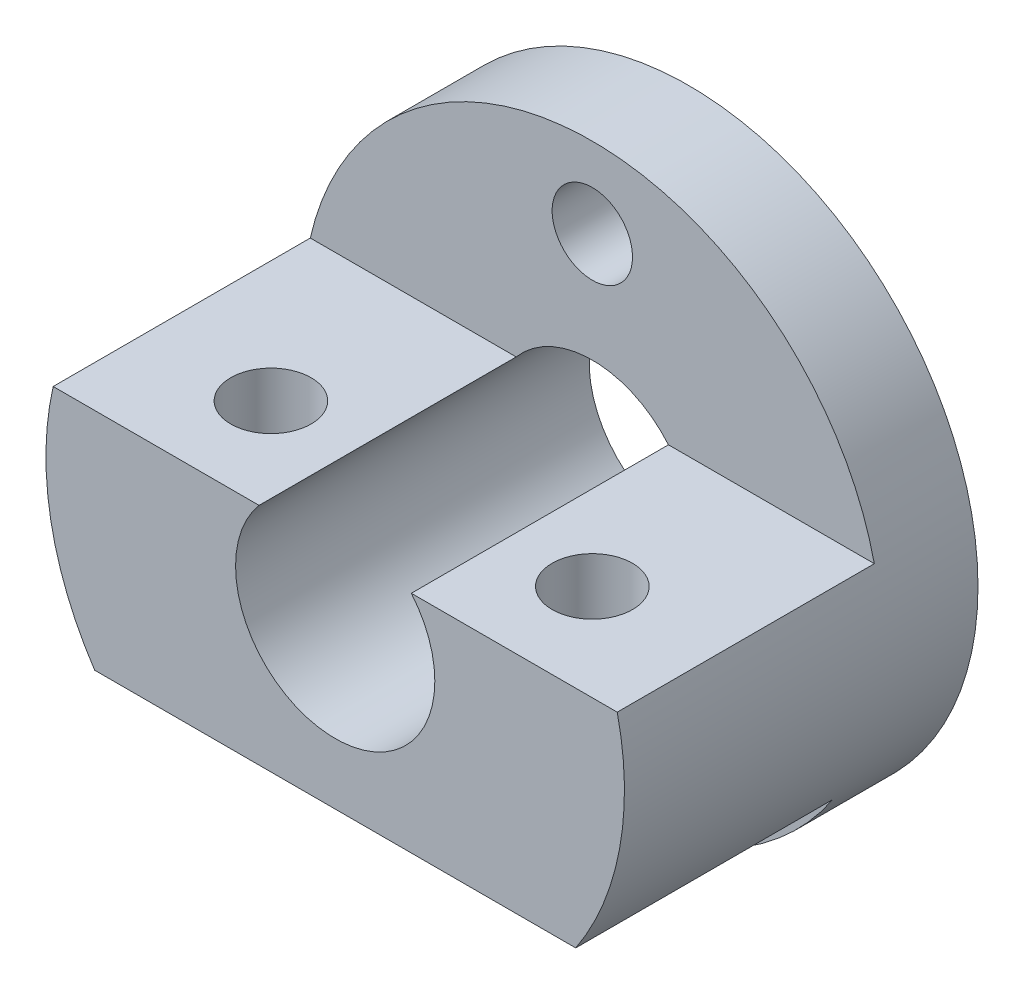
from build123d import *

# Parameters (mm, degrees)
SKETCH_1_R          = 9.5
EXTRUDE_1_DEPTH     = 3
SKETCH_3_R          = 9
EXTRUDE_2_DEPTH     = 13
CUT_EXTRUDE_START   = -13
CUT_EXTRUDE_2_DEPTH = 13
SKETCH_5_R          = 3.1
CUT_EXTRUDE_3_DEPTH = 20
CUT_EXTRUDE_START_2 = -5
SKETCH_8_R          = 9
CUT_EXTRUDE_6_DEPTH = 5
SKETCH_9_OUTSIDE_W  = 26.806
SKETCH_9_OUTSIDE_H  = 26.806
SKETCH_9_OUTSIDE_R  = 9
CUT_EXTRUDE_7_DEPTH = 13
HOLE_WIZARD_M3_1_D  = 2.5
HOLE_WIZARD_M3_2_D  = 2.5


with BuildPart() as part:
    # 草图1 → 凸台-拉伸1 (new body)
    with BuildSketch(Plane.XY):
        Circle(SKETCH_1_R)
    extrude(amount=EXTRUDE_1_DEPTH)

    # 草图3 → 凸台-拉伸2 (add)
    with BuildSketch(Plane.XY.offset(3)):
        Circle(SKETCH_3_R)
    extrude(amount=EXTRUDE_2_DEPTH)

    # 草图4 → 切除-拉伸2 (cut)
    with BuildSketch(Plane.XY.offset(16).offset(CUT_EXTRUDE_START)):
        with BuildLine():
            Line((-8.774964387, 2), (8.774964387, 2))
            ThreePointArc((8.774964387, 2), (0, 9), (-8.774964387, 2))
        make_face()
        with BuildLine():
            Line((-7.483314774, -5), (7.483314774, -5))
            ThreePointArc((7.483314774, -5), (0, -9), (-7.483314774, -5))
        make_face()
    extrude(amount=CUT_EXTRUDE_2_DEPTH, mode=Mode.SUBTRACT)

    # 草图5 → 切除-拉伸3 (cut)
    with BuildSketch(Plane.XY.offset(16)):
        Circle(SKETCH_5_R)
    extrude(amount=-CUT_EXTRUDE_3_DEPTH, mode=Mode.SUBTRACT)

    # 草图8 → 切除-拉伸6 (cut)
    with BuildSketch(Plane.XY.offset(16).offset(CUT_EXTRUDE_START_2)):
        Circle(SKETCH_8_R)
    extrude(amount=CUT_EXTRUDE_6_DEPTH, mode=Mode.SUBTRACT)

    # 草图9 outside → 切除-拉伸7 (cut)
    with BuildSketch(Plane.XY.offset(3)):
        Rectangle(SKETCH_9_OUTSIDE_W, SKETCH_9_OUTSIDE_H)
        Circle(SKETCH_9_OUTSIDE_R, mode=Mode.SUBTRACT)
    extrude(amount=-CUT_EXTRUDE_7_DEPTH, mode=Mode.SUBTRACT)

    # M3 螺纹孔1 (through all)
    with Locations(Plane(origin=(0, 2, 0), x_dir=(1, 0, 0), z_dir=(0, 1, 0))):
        with Locations((-5, -8), (5, -8)):
            Hole(HOLE_WIZARD_M3_1_D / 2)

    # M3 螺纹孔2 (through all)
    with Locations(Plane.XY.offset(3)):
        with Locations((0, 6.5), (0, -6.5)):
            Hole(HOLE_WIZARD_M3_2_D / 2)


solid = part.part
